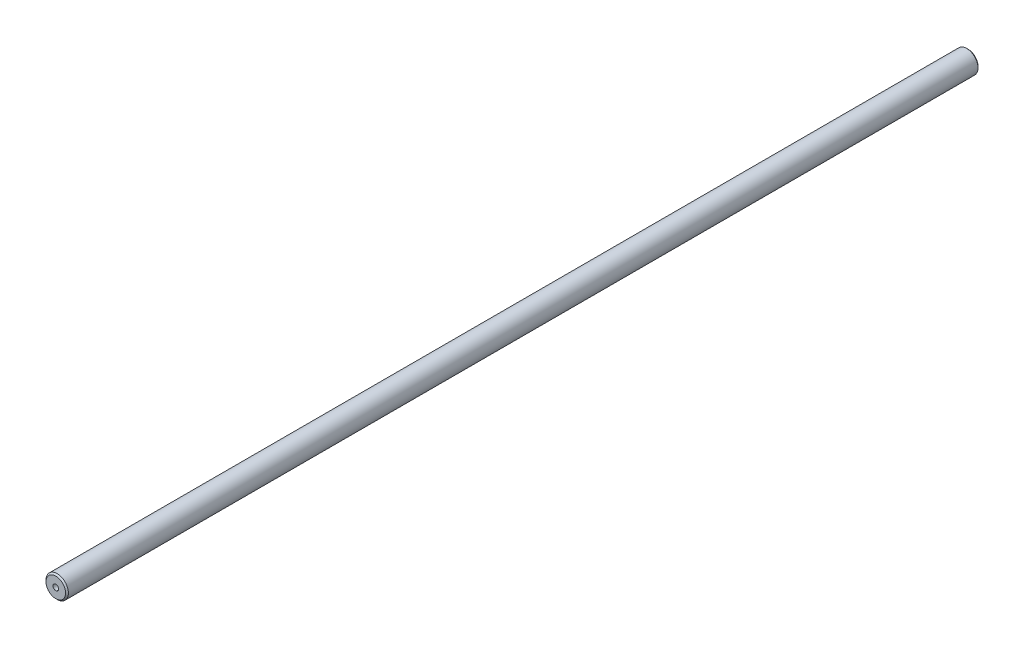
from build123d import *

# Parameters (mm, degrees)
SKETCH1_R           = 4
BOSS_EXTRUDE1_DEPTH = 326
SKETCH2_R           = 1
CUT_EXTRUDE1_DEPTH  = 10
CHAMFER1_SIZE       = 0.5


with BuildPart() as part:
    # Sketch1 → Boss-Extrude1 (new body)
    with BuildSketch(Plane.XY):
        Circle(SKETCH1_R)
    extrude(amount=BOSS_EXTRUDE1_DEPTH)

    # Sketch2 → Cut-Extrude1 (cut)
    with BuildSketch(Plane.XY.offset(326)):
        Circle(SKETCH2_R)
    extrude(amount=-CUT_EXTRUDE1_DEPTH, mode=Mode.SUBTRACT)

    # Chamfer1
    chamfer1_edges = [part.edges().sort_by_distance(p)[0] for p in [
        (-4, 0, 0),
        (-4, 0, 326),
    ]]
    chamfer(chamfer1_edges, length=CHAMFER1_SIZE)


solid = part.part
